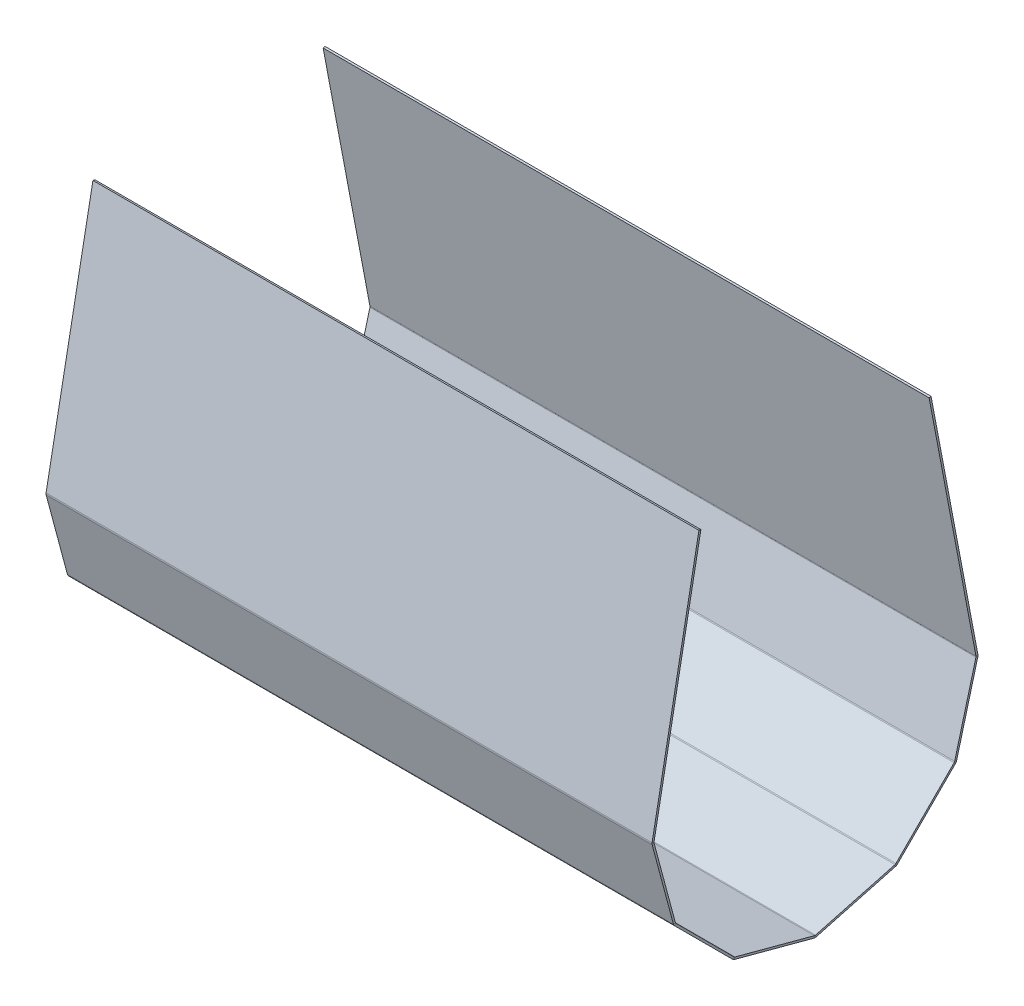
from build123d import *

# Parameters (mm, degrees)
BOSS_EXTRUDE1_DEPTH    = 457.2
CONVERT_SOLID1_DEPTH   = 457.2
CONVERT_SOLID1_2_DEPTH = 457.2


# Read off the part's stored shape, not the designer's step: Convert-Solid1
with BuildPart() as part:
    # Sketch1 → Boss-Extrude1 (new body)
    with BuildSketch(Plane(origin=(0, 0, 0), x_dir=(0, 0, 1), z_dir=(1, 0, 0))):
        Polygon((-29.751953414, 596.435252585), (-65.16880823, 409.640335681), (-63.546707453, 409.332780696), (-28.059593886, 596.498254998), (-28.279614725, 597.319383946), (-44.285546712, 657.054335345), (-44.538099225, 657.996874156), (-45.228085523, 658.686860454), (-88.95625047, 702.415025401), (-89.646236768, 703.105011699), (-90.588775579, 703.357564213), (-150.322559758, 719.363183444), (-151.265098569, 719.615735957), (-152.20763738, 719.363183444), (-211.941421559, 703.357564213), (-212.88396037, 703.105011699), (-213.573946668, 702.415025401), (-257.302111615, 658.686860454), (-257.992097913, 657.996874156), (-258.244650426, 657.054335345), (-274.250582413, 597.319383946), (-274.470603252, 596.498254998), (-238.983489685, 409.332780696), (-237.361388908, 409.640335681), (-272.778243724, 596.435252585), (-272.655838874, 596.892073703), (-256.649906887, 656.627025102), (-256.511851808, 657.14225367), (-256.134678319, 657.519427159), (-212.406513372, 701.247592106), (-212.029339883, 701.624765595), (-211.514111315, 701.762820673), (-151.780327137, 717.768439905), (-151.265098569, 717.906494983), (-150.749870001, 717.768439905), (-91.016085823, 701.762820673), (-90.500857255, 701.624765595), (-90.123683766, 701.247592106), (-46.395518819, 657.519427159), (-46.01834533, 657.14225367), (-45.880290251, 656.627025102), (-29.874358264, 596.892073703), align=None)
    extrude(amount=BOSS_EXTRUDE1_DEPTH)

    # Convert-Solid1 outline → Convert-Solid1 (cut)
    with BuildSketch(Plane.YZ):
        with BuildLine():
            Line((-409.332780696, -238.983489685), (-409.360909589, -238.8351328))
            Line((-409.360909589, -238.8351328), (-595.819160173, -274.188154711))
            ThreePointArc((-595.819160173, -274.188154711), (-596.489617721, -274.238590248), (-597.154469491, -274.138444405))
            Line((-597.154469491, -274.138444405), (-657.14225367, -258.064766079))
            ThreePointArc((-657.14225367, -258.064766079), (-657.865796534, -257.765064811), (-658.487116878, -257.288308944))
            Line((-658.487116878, -257.288308944), (-702.40122273, -213.374203091))
            ThreePointArc((-702.40122273, -213.374203091), (-702.877978598, -212.752882748), (-703.177679865, -212.029339883))
            Line((-703.177679865, -212.029339883), (-719.251358192, -152.041555704))
            ThreePointArc((-719.251358192, -152.041555704), (-719.353580713, -151.265098569), (-719.251358192, -150.488641434))
            Line((-719.251358192, -150.488641434), (-703.177679865, -90.500857255))
            ThreePointArc((-703.177679865, -90.500857255), (-702.877978598, -89.77731439), (-702.40122273, -89.155994047))
            Line((-702.40122273, -89.155994047), (-658.487116878, -45.241888194))
            ThreePointArc((-658.487116878, -45.241888194), (-657.865796534, -44.765132327), (-657.14225367, -44.465431059))
            Line((-657.14225367, -44.465431059), (-597.154469491, -28.391752733))
            ThreePointArc((-597.154469491, -28.391752733), (-596.489617721, -28.29160689), (-595.819160173, -28.342042427))
            Line((-595.819160173, -28.342042427), (-409.360909589, -63.695064338))
            Line((-409.360909589, -63.695064338), (-409.332780696, -63.546707453))
            Line((-409.332780696, -63.546707453), (-596.498254998, -28.059593886))
            Line((-596.498254998, -28.059593886), (-657.996874156, -44.538099225))
            Line((-657.996874156, -44.538099225), (-703.105011699, -89.646236768))
            Line((-703.105011699, -89.646236768), (-719.615735957, -151.265098569))
            Line((-719.615735957, -151.265098569), (-703.105011699, -212.88396037))
            Line((-703.105011699, -212.88396037), (-657.996874156, -257.992097913))
            Line((-657.996874156, -257.992097913), (-596.498254998, -274.470603252))
            Line((-596.498254998, -274.470603252), (-409.332780696, -238.983489685))
        make_face()
    extrude(amount=CONVERT_SOLID1_DEPTH, mode=Mode.SUBTRACT)

    # Convert-Solid1 2 outline → Convert-Solid1 2 (add)
    with BuildSketch(Plane.YZ):
        with BuildLine():
            ThreePointArc((-596.098586265, -272.714410818), (-596.433815038, -272.739628587), (-596.766240923, -272.689555666))
            Line((-596.766240923, -272.689555666), (-596.435252585, -272.778243724))
            Line((-596.435252585, -272.778243724), (-596.098586265, -272.714410818))
        make_face()
        with BuildLine():
            Line((-657.14225367, -256.511851808), (-656.754025102, -256.615877339))
            ThreePointArc((-656.754025102, -256.615877339), (-657.115796534, -256.466026706), (-657.426456706, -256.227648772))
            Line((-657.426456706, -256.227648772), (-657.14225367, -256.511851808))
        make_face()
        with BuildLine():
            Line((-701.624765595, -212.029339883), (-701.340562558, -212.313542919))
            ThreePointArc((-701.340562558, -212.313542919), (-701.578940492, -212.002882747), (-701.728791126, -211.641111315))
            Line((-701.728791126, -211.641111315), (-701.624765595, -212.029339883))
        make_face()
        with BuildLine():
            Line((-717.906494983, -151.265098569), (-717.802469452, -151.653327137))
            ThreePointArc((-717.802469452, -151.653327137), (-717.853580713, -151.265098569), (-717.802469452, -150.876870001))
            Line((-717.802469452, -150.876870001), (-717.906494983, -151.265098569))
        make_face()
        with BuildLine():
            Line((-701.624765595, -90.500857255), (-701.728791126, -90.889085823))
            ThreePointArc((-701.728791126, -90.889085823), (-701.578940492, -90.527314391), (-701.340562558, -90.216654219))
            Line((-701.340562558, -90.216654219), (-701.624765595, -90.500857255))
        make_face()
        with BuildLine():
            Line((-657.14225367, -46.01834533), (-657.426456706, -46.302548366))
            ThreePointArc((-657.426456706, -46.302548366), (-657.115796534, -46.064170432), (-656.754025102, -45.914319799))
            Line((-656.754025102, -45.914319799), (-657.14225367, -46.01834533))
        make_face()
        with BuildLine():
            Line((-596.435252585, -29.751953414), (-596.766240923, -29.840641472))
            ThreePointArc((-596.766240923, -29.840641472), (-596.433815038, -29.790568551), (-596.098586265, -29.815786319))
            Line((-596.098586265, -29.815786319), (-596.435252585, -29.751953414))
        make_face()
    extrude(amount=CONVERT_SOLID1_2_DEPTH)


solid = part.part
